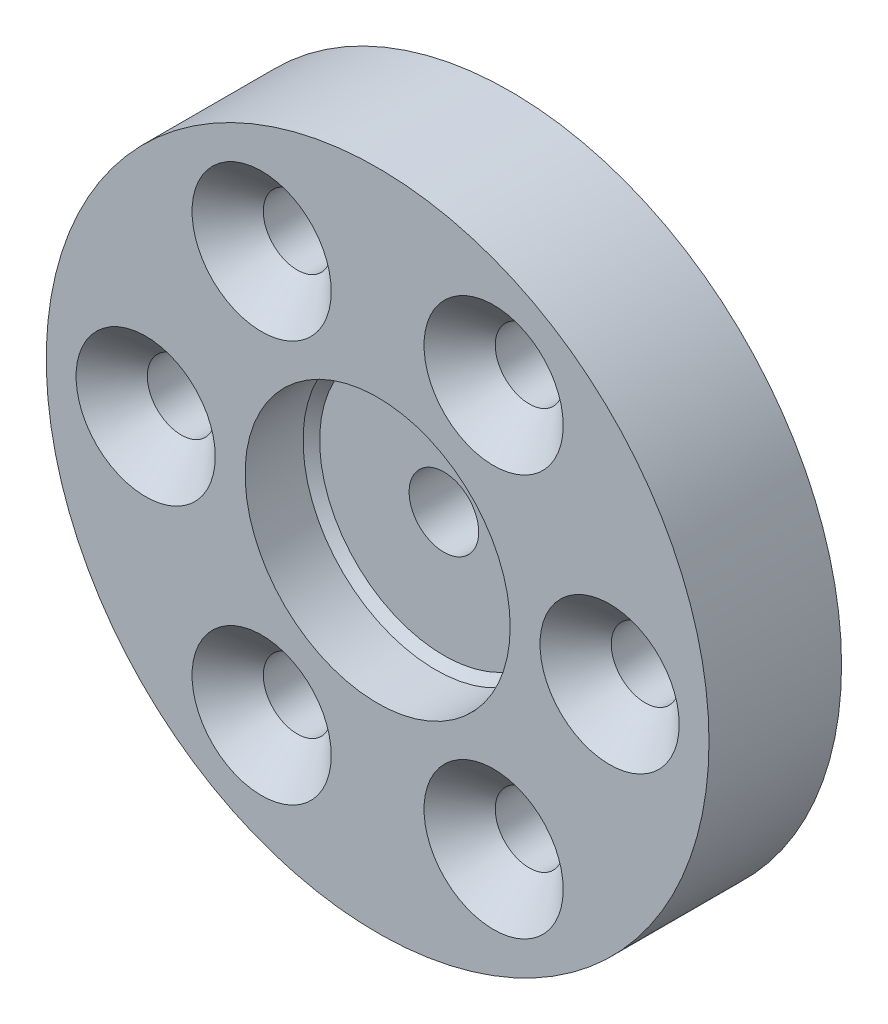
from build123d import *

# Parameters (mm, degrees)
SKETCH1_R                                           = 20
BOSS_EXTRUDE1_DEPTH                                 = 8
CSK_FOR_M4_COUNTERSUNK_FLAT_HEAD_SCREW1_D           = 4.1
CSK_FOR_M4_COUNTERSUNK_FLAT_HEAD_SCREW1_CSINK_D     = 8.4
CSK_FOR_M4_COUNTERSUNK_FLAT_HEAD_SCREW1_CSINK_ANGLE = 90
SKETCH11_R                                          = 8
CUT_EXTRUDE3_DEPTH                                  = 4
M5_TAPPED_HOLE1_D                                   = 4.2
CHAMFER1_SIZE                                       = 0.5


with BuildPart() as part:
    # Sketch1 → Boss-Extrude1 (new body)
    with BuildSketch(Plane.XY):
        Circle(SKETCH1_R)
    extrude(amount=BOSS_EXTRUDE1_DEPTH)

    # CSK for M4 Countersunk Flat Head Screw1 (through all)
    with Locations(Plane.XY.offset(8)):
        with Locations((7, 12.124355653), (-14, 0), (-7, 12.124355653), (-7, -12.124355653), (14, 0), (7, -12.124355653)):
            CounterSinkHole(CSK_FOR_M4_COUNTERSUNK_FLAT_HEAD_SCREW1_D / 2, CSK_FOR_M4_COUNTERSUNK_FLAT_HEAD_SCREW1_CSINK_D / 2, counter_sink_angle=CSK_FOR_M4_COUNTERSUNK_FLAT_HEAD_SCREW1_CSINK_ANGLE)

    # Sketch11 → Cut-Extrude3 (cut)
    with BuildSketch(Plane.XY.offset(8)):
        Circle(SKETCH11_R)
    extrude(amount=-CUT_EXTRUDE3_DEPTH, mode=Mode.SUBTRACT)

    # M5 Tapped Hole1 (through all)
    with Locations(Plane.XY.offset(4)):
        with Locations((0, 0)):
            Hole(M5_TAPPED_HOLE1_D / 2)

    # Chamfer1
    chamfer1_edges = [part.edges().sort_by_distance(p)[0] for p in [
        (-8, 0, 4),
    ]]
    chamfer(chamfer1_edges, length=CHAMFER1_SIZE)


solid = part.part
